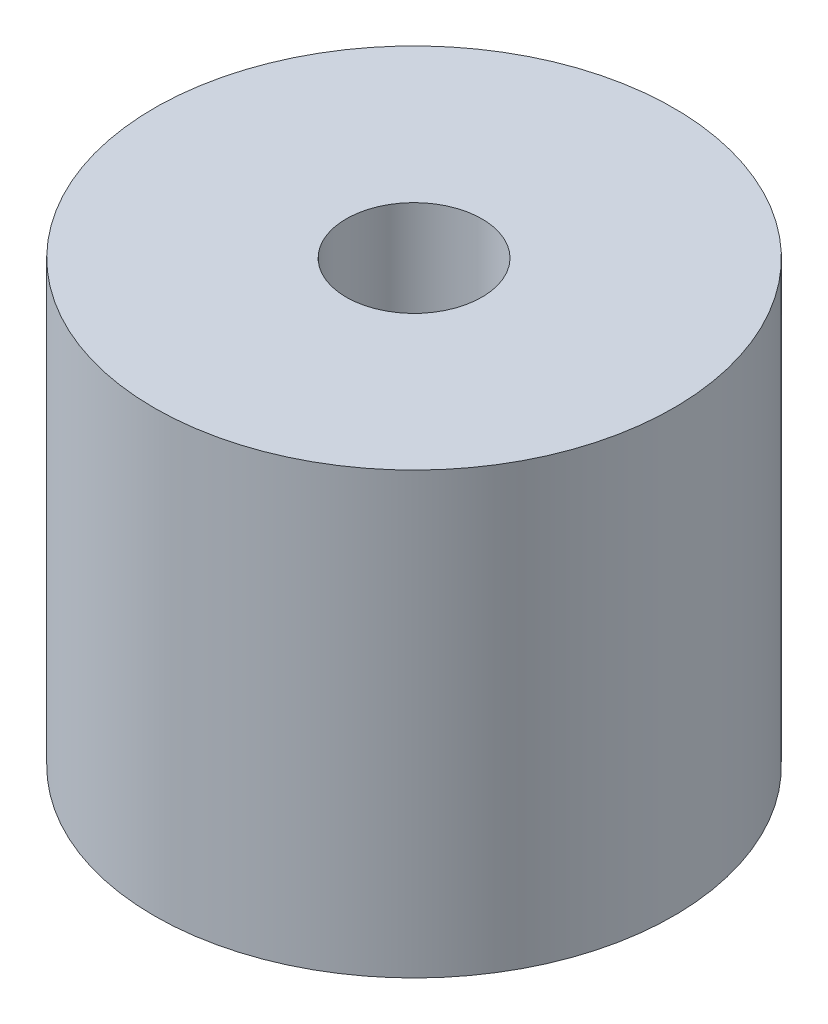
from build123d import *

# Parameters (mm, degrees)
SKETCH1_R              = 9.525
BOSS_EXTRUDE1_DEPTH    = 16.129
F_10_CLEARANCE_HOLE1_D = 4.9784


with BuildPart() as part:
    # Sketch1 → Boss-Extrude1 (new body)
    with BuildSketch(Plane(origin=(0, 0, 0), x_dir=(1, 0, 0), z_dir=(0, 1, 0))):
        Circle(SKETCH1_R)
    extrude(amount=BOSS_EXTRUDE1_DEPTH)

    # #10 Clearance Hole1 (through all)
    with Locations(Plane(origin=(0, 16.129, 0), x_dir=(1, 0, 0), z_dir=(0, 1, 0))):
        with Locations((0, 0)):
            Hole(F_10_CLEARANCE_HOLE1_D / 2)


solid = part.part
